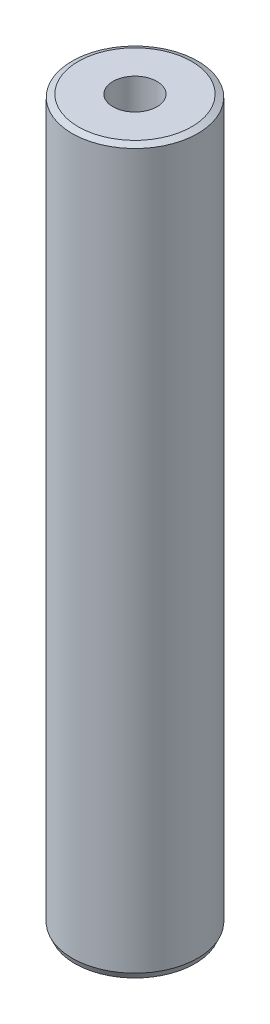
from build123d import *
from OCP.BRepFilletAPI import BRepFilletAPI_MakeChamfer

# Parameters (mm, degrees)
SKETCH1_R           = 12.5
BOSS_EXTRUDE1_DEPTH = 143.914848492
SKETCH2_R           = 4.382029501
CUT_EXTRUDE1_DEPTH  = 145.996495187
CHAMFER1_SIZE       = 0.54843357
CHAMFER1_SIZE2      = 1.214728581


with BuildPart() as part:
    # Sketch1 → Boss-Extrude1 (new body)
    with BuildSketch(Plane(origin=(0, 0, 0), x_dir=(1, 0, 0), z_dir=(0, 1, 0))):
        Circle(SKETCH1_R)
    extrude(amount=BOSS_EXTRUDE1_DEPTH)

    # Sketch2 → Cut-Extrude1 (cut, through all)
    with BuildSketch(Plane(origin=(0, 0, 0), x_dir=(1, 0, 0), z_dir=(0, 1, 0))):
        Circle(SKETCH2_R)
    extrude(amount=CUT_EXTRUDE1_DEPTH, mode=Mode.SUBTRACT)

    # Chamfer1: one chamfer whose edges measure the first distance from different faces: ONE call of the kernel's chamfer builder (chamfer() names one face for all edges)
    chamfer1_edges_1 = [part.edges().sort_by_distance(p)[0] for p in [
        (-12.5, 143.914848492, 0),
    ]]
    chamfer1_side_1 = [part.faces().sort_by_distance(p)[0] for p in [
        (-12.5, 71.957424246, 0),
    ]]
    chamfer1_edges_2 = [part.edges().sort_by_distance(p)[0] for p in [
        (-12.5, 0, 0),
    ]]
    chamfer1_side_2 = [part.faces().sort_by_distance(p)[0] for p in [
        (-12.146446609, 0, 0),
    ]]
    chamfer1 = BRepFilletAPI_MakeChamfer(part.part.solid().wrapped)
    for e in chamfer1_edges_1:
        chamfer1.Add(CHAMFER1_SIZE, CHAMFER1_SIZE2, e.wrapped, chamfer1_side_1[0].wrapped)  # the first distance lies on this face
    for e in chamfer1_edges_2:
        chamfer1.Add(CHAMFER1_SIZE, CHAMFER1_SIZE2, e.wrapped, chamfer1_side_2[0].wrapped)  # the first distance lies on this face
    add(Compound.cast(chamfer1.Shape()), mode=Mode.REPLACE)


solid = part.part
